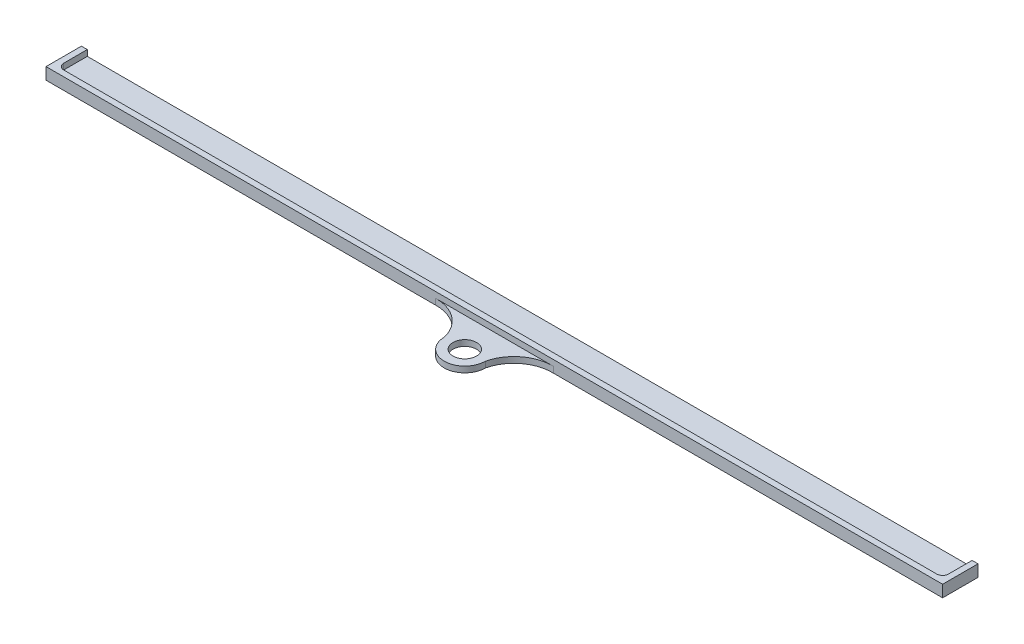
from build123d import *

# Parameters (mm, degrees)
SKETCH2_R           = 7
SKETCH2_R_2         = 4
BOSS_EXTRUDE2_DEPTH = 2
BOSS_EXTRUDE4_START = -2
BOSS_EXTRUDE4_DEPTH = 4


with BuildPart() as part:
    # Sketch2 → Boss-Extrude2 (new body)
    # profile 1 of 3: a face of its own
    with BuildSketch(Plane(origin=(0, 0, 0), x_dir=(1, 0, 0), z_dir=(0, 1, 0))):
        with BuildLine():
            Line((-152, 6), (-152, -6))
            Line((-152, -6), (-20, -6))
            ThreePointArc((-20, -6), (-19.650225915, -5.99529369), (-19.300451831, -6))
            Line((-19.300451831, -6), (19.300451831, -6))
            ThreePointArc((19.300451831, -6), (19.650225915, -5.99529369), (20, -6))
            Line((20, -6), (152, -6))
            Line((152, -6), (152, 6))
            Line((152, 6), (-152, 6))
        make_face()
    # profile 2 of 3: a face of its own
    with BuildSketch(Plane(origin=(0, 0, 0), x_dir=(1, 0, 0), z_dir=(0, 1, 0))):
        with BuildLine():
            Line((19.300451831, -6), (-19.300451831, -6))
            ThreePointArc((-19.300451831, -6), (-11.449616182, -8.908173189), (-7, -16))
            ThreePointArc((-7, -16), (0, -9), (7, -16))
            ThreePointArc((7, -16), (11.449616182, -8.908173189), (19.300451831, -6))
        make_face()
    # profile 3 of 3: a face of its own
    with BuildSketch(Plane(origin=(0, 0, 0), x_dir=(1, 0, 0), z_dir=(0, 1, 0))):
        with Locations((0, -16)):
            Circle(SKETCH2_R)
        with Locations(Location((0, -16, 0), (0, 0, 270))):
            Circle(SKETCH2_R_2, mode=Mode.SUBTRACT)
    extrude(amount=-BOSS_EXTRUDE2_DEPTH)

    # Boss-Extrude4: read off the stored shape, not the designer's step
    # Boss-Extrude4 outline → Boss-Extrude4 (add)
    with BuildSketch(Plane(origin=(0, 0, 0), x_dir=(1, 0, 0), z_dir=(0, 1, 0)).offset(BOSS_EXTRUDE4_START)):
        with BuildLine():
            Line((-152, 6), (-152, -6))
            Line((-152, -6), (152, -6))
            Line((152, -6), (152, 6))
            Line((152, 6), (150, 6))
            Line((150, 6), (150, -2))
            ThreePointArc((150, -2), (149.414213562, -3.414213562), (148, -4))
            Line((148, -4), (-148, -4))
            ThreePointArc((-148, -4), (-149.414213562, -3.414213562), (-150, -2))
            Line((-150, -2), (-150, 6))
            Line((-150, 6), (-152, 6))
        make_face()
    extrude(amount=BOSS_EXTRUDE4_DEPTH)


solid = part.part
